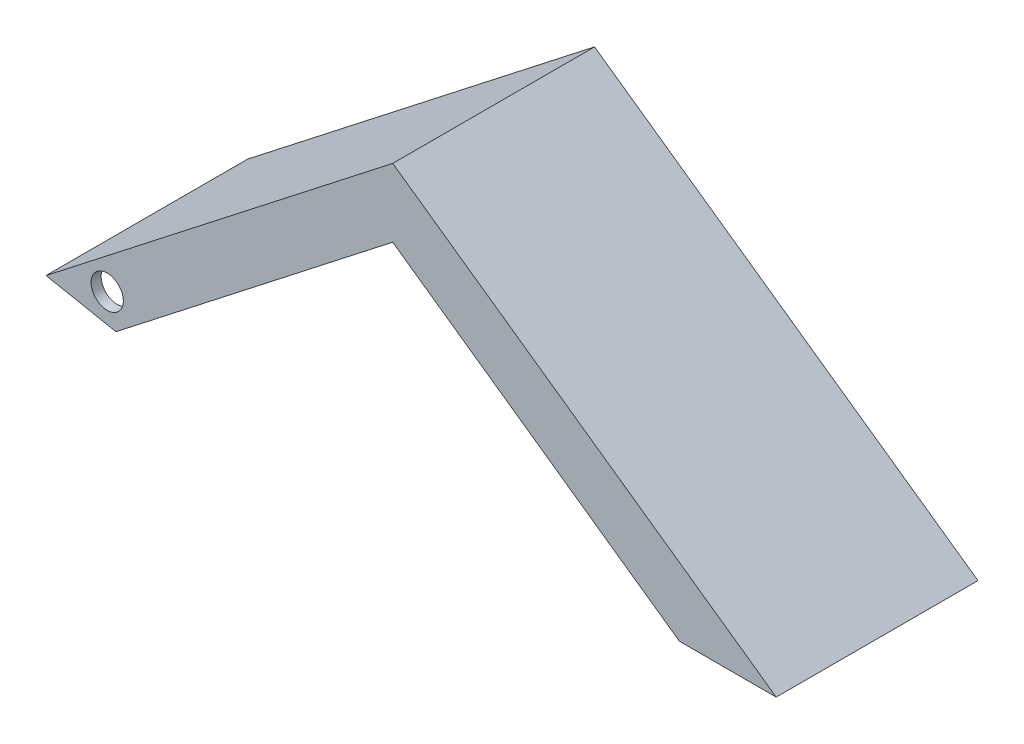
from build123d import *

# Parameters (mm, degrees)
BOSS_EXTRUDE1_DEPTH = 10
SKETCH3_R           = 0.8
CUT_EXTRUDE1_DEPTH  = 10
SHELL3_START        = 0.5
SHELL3_DEPTH        = 9


# Read off the part's stored shape, not the designer's step: Shell3
with BuildPart() as part:
    # Sketch1 → Boss-Extrude1 (new body)
    with BuildSketch(Plane.XY):
        Polygon((0, 0), (17.18164136, 13.403124393), (36.182713788, 0), (31.388050652, 0), (17.18164136, 10.021027584), (3.469055949, -0.675941592), align=None)
    extrude(amount=BOSS_EXTRUDE1_DEPTH)

    # Sketch3 → Cut-Extrude1 (cut)
    with BuildSketch(Plane.XY.offset(10)):
        with Locations((3.03145353, 0.822261973)):
            Circle(SKETCH3_R)
    extrude(amount=-CUT_EXTRUDE1_DEPTH, mode=Mode.SUBTRACT)

    # Shell3 outline → Shell3 (cut)
    with BuildSketch(Plane.XY.offset(SHELL3_START)):
        with BuildLine():
            ThreePointArc((2.871909903, 1.606191709), (3.523511931, 0.19148584), (2.309922075, 1.167793967))
            Line((2.309922075, 1.167793967), (0.650444145, -0.126738299))
            Line((0.650444145, -0.126738299), (2.818611804, -0.549203293))
            Line((2.818611804, -0.549203293), (17.16665434, 10.643475851))
            Line((17.16665434, 10.643475851), (31.546653635, 0.5))
            Line((31.546653635, 0.5), (34.606450873, 0.5))
            Line((34.606450873, 0.5), (17.196628379, 12.780676126))
            Line((17.196628379, 12.780676126), (2.871909903, 1.606191709))
        make_face()
    extrude(amount=SHELL3_DEPTH, mode=Mode.SUBTRACT)


solid = part.part
